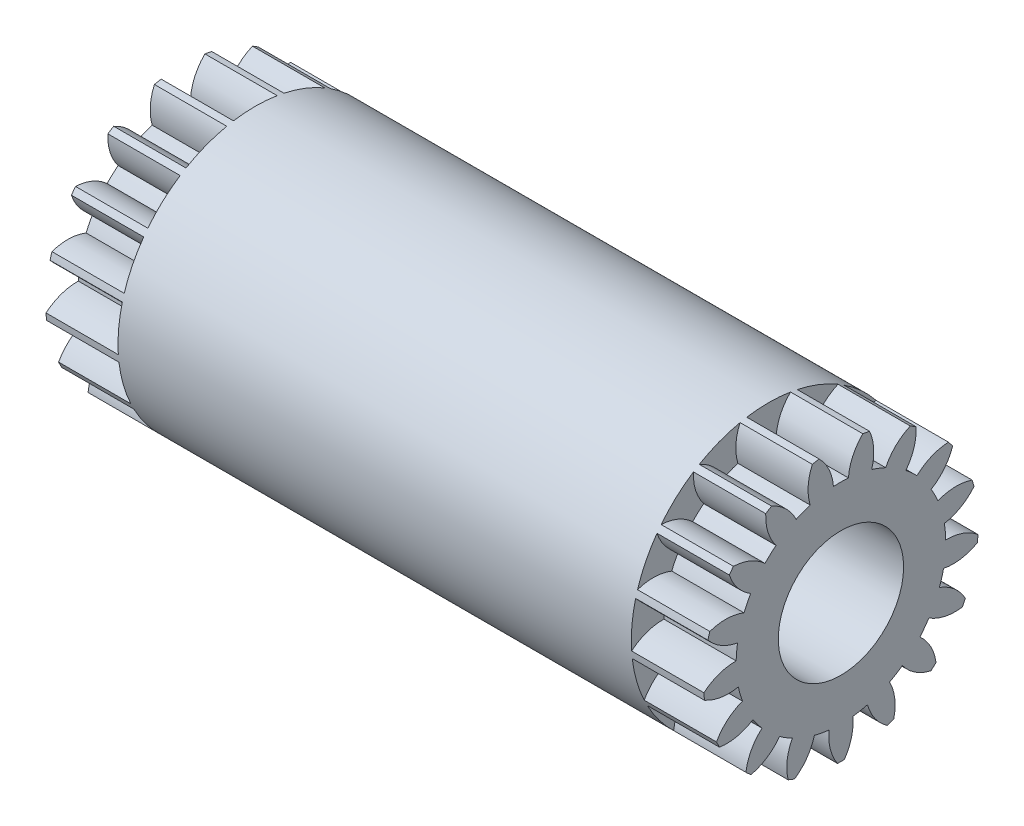
from build123d import *
from build123d.topology import SkipClean

# Parameters (mm, degrees)
BASPROSKE_W         = 3
BASPROSKE_H         = 5.7
TOOTHCUT_DEPTH      = 9.601162712
TEETHCUTS_COUNT     = 17
TEETHCUTS_ANGLE     = 338.823529412
HUBNEABOTSKE_R      = 1.5
HUBNEARBOTH_DEPTH   = 23.5000254
HUBFAR_START        = 23.5000254
HUBFARSKE_R         = 1.5
HUBFAR_DEPTH        = 23.5000254
BORSKE_R            = 2.5
BORE_DEPTH          = 50.0000508
EXTRUDE_START       = 21.3
SKETCH_2_R          = 5.7
EXTRUDE_1_DEPTH     = 21.3
EXTRUDE_2_DEPTH     = 3
SKETCH_4_R          = 2.6
CUT_EXTRUDE_1_DEPTH = 29.465241963


with BuildPart() as part:
    # BasProSke → Base-Revolve (revolve)
    with BuildSketch(Plane(origin=(0, 0, 0), x_dir=(1, 0, 0), z_dir=(0, 1, 0))):
        with Locations((1.5, 2.85)):
            Rectangle(BASPROSKE_W, BASPROSKE_H)
    revolve(axis=Axis((-10, 0, 0), (1, 0, 0)))

    # TooCutSke → ToothCut (cut, through all)
    with BuildSketch(Plane(origin=(0, 0, 0), x_dir=(0, 0, -1), z_dir=(1, 0, 0))):
        with BuildLine():
            ThreePointArc((0.310384518, 4.337909917), (0, 4.349), (-0.310384518, 4.337909917))
            ThreePointArc((-0.310384518, 4.337909917), (-0.499365984, 5.050550631), (-0.929319613, 5.649475216))
            ThreePointArc((-0.929319613, 5.649475216), (0, 5.7254), (0.929319613, 5.649475216))
            ThreePointArc((0.929319613, 5.649475216), (0.499365984, 5.050550631), (0.310384518, 4.337909917))
        make_face()
    toothcut = extrude(amount=TOOTHCUT_DEPTH, mode=Mode.SUBTRACT)

    # TeethCuts: ToothCut ×17 about axis
    teethcuts_axis = Axis((-10, 0, 0), (1, 0, 0))
    for i in range(1, TEETHCUTS_COUNT):
        add(toothcut.rotate(teethcuts_axis, i * TEETHCUTS_ANGLE / (TEETHCUTS_COUNT - 1)), mode=Mode.SUBTRACT)

    # HubNeaBotSke → HubNearBoth (add)
    with BuildSketch(Plane.ZY):
        Circle(HUBNEABOTSKE_R)
    extrude(amount=HUBNEARBOTH_DEPTH)

    # HubFarSke → HubFar (add)
    with BuildSketch(Plane(origin=(3, 0, 0), x_dir=(0, 0, -1), z_dir=(1, 0, 0)).offset(HUBFAR_START)):
        Circle(HUBFARSKE_R)
    extrude(amount=-HUBFAR_DEPTH)

    # BorSke → Bore (cut, symmetric)
    with BuildSketch(Plane(origin=(0, 0, 0), x_dir=(0, 0, -1), z_dir=(1, 0, 0))):
        Circle(BORSKE_R)
    extrude(amount=BORE_DEPTH, both=True, mode=Mode.SUBTRACT)

    # 草图2 → 凸台-拉伸1 (add)
    with BuildSketch(Plane(origin=(3, 0, 0), x_dir=(0, 0, -1), z_dir=(1, 0, 0)).offset(EXTRUDE_START)):
        Circle(SKETCH_2_R)
    extrude(amount=-EXTRUDE_1_DEPTH)

    # 草图3 → 凸台-拉伸2 (add)
    with SkipClean():  # the faces are left unmerged after this step: merging them gives an invalid solid
        with BuildSketch(Plane(origin=(24.3, 0, 0), x_dir=(0, 0, -1), z_dir=(1, 0, 0))):
            with BuildLine():
                ThreePointArc((-5.51974328, 1.422123104), (-4.969313038, 0.955273271), (-4.290766488, 0.709312304))
                ThreePointArc((-4.290766488, 0.709312304), (-4.330447933, 0.401275095), (-4.348043829, 0.091191359))
                ThreePointArc((-4.348043829, 0.091191359), (-5.060232043, -0.025899053), (-5.687073596, -0.38365859))
                ThreePointArc((-5.687073596, -0.38365859), (-5.675684805, -0.525929649), (-5.660737442, -0.667870958))
                ThreePointArc((-5.660737442, -0.667870958), (-4.978830915, -0.904357125), (-4.257253752, -0.88858961))
                ThreePointArc((-4.257253752, -0.88858961), (-4.182979722, -1.190160344), (-4.087372241, -1.485661187))
                ThreePointArc((-4.087372241, -1.485661187), (-4.709170038, -1.852116803), (-5.164444727, -2.412158922))
                ThreePointArc((-5.164444727, -2.412158922), (-5.102430761, -2.540708628), (-5.037217645, -2.667665346))
                ThreePointArc((-5.037217645, -2.667665346), (-4.315930089, -2.64184908), (-3.648775306, -2.366482573))
                ThreePointArc((-3.648775306, -2.366482573), (-3.470576921, -2.620858034), (-3.274678383, -2.861866958))
                ThreePointArc((-3.274678383, -2.861866958), (-3.722108524, -3.428195915), (-3.94432898, -4.114883826))
                ThreePointArc((-3.94432898, -4.114883826), (-3.840065169, -4.212350828), (-3.733393692, -4.307176748))
                ThreePointArc((-3.733393692, -4.307176748), (-3.070138988, -4.022544678), (-2.547509536, -3.524768952))
                ThreePointArc((-2.547509536, -3.524768952), (-2.289453476, -3.697594323), (-2.019721064, -3.851561738))
                ThreePointArc((-2.019721064, -3.851561738), (-2.232355629, -4.541278172), (-2.191509748, -5.261870867))
                ThreePointArc((-2.191509748, -5.261870867), (-2.059077497, -5.315091708), (-1.925354235, -5.364980062))
                ThreePointArc((-1.925354235, -5.364980062), (-1.409708605, -4.859973327), (-1.102188487, -4.207015752))
                ThreePointArc((-1.102188487, -4.207015752), (-0.799126653, -4.274950011), (-0.491989224, -4.321081763))
                ThreePointArc((-0.491989224, -4.321081763), (-0.441110737, -5.041035649), (-0.142714981, -5.698213091))
                ThreePointArc((-0.142714981, -5.698213091), (0, -5.7), (0.142714981, -5.698213091))
                ThreePointArc((0.142714981, -5.698213091), (0.441110737, -5.041035649), (0.491989224, -4.321081763))
                ThreePointArc((0.491989224, -4.321081763), (0.799126653, -4.274950011), (1.102188487, -4.207015752))
                ThreePointArc((1.102188487, -4.207015752), (1.409708605, -4.859973327), (1.925354235, -5.364980062))
                ThreePointArc((1.925354235, -5.364980062), (2.059077497, -5.315091708), (2.191509748, -5.261870867))
                ThreePointArc((2.191509748, -5.261870867), (2.232355629, -4.541278172), (2.019721064, -3.851561738))
                ThreePointArc((2.019721064, -3.851561738), (2.289453476, -3.697594323), (2.547509536, -3.524768952))
                ThreePointArc((2.547509536, -3.524768952), (3.070138988, -4.022544678), (3.733393692, -4.307176748))
                ThreePointArc((3.733393692, -4.307176748), (3.840065169, -4.212350828), (3.94432898, -4.114883826))
                ThreePointArc((3.94432898, -4.114883826), (3.722108524, -3.428195915), (3.274678383, -2.861866958))
                ThreePointArc((3.274678383, -2.861866958), (3.470576921, -2.620858034), (3.648775306, -2.366482573))
                ThreePointArc((3.648775306, -2.366482573), (4.315930089, -2.64184908), (5.037217645, -2.667665346))
                ThreePointArc((5.037217645, -2.667665346), (5.102430761, -2.540708628), (5.164444727, -2.412158922))
                ThreePointArc((5.164444727, -2.412158922), (4.709170038, -1.852116803), (4.087372241, -1.485661187))
                ThreePointArc((4.087372241, -1.485661187), (4.182979722, -1.190160344), (4.257253752, -0.88858961))
                ThreePointArc((4.257253752, -0.88858961), (4.978830915, -0.904357125), (5.660737442, -0.667870958))
                ThreePointArc((5.660737442, -0.667870958), (5.675684805, -0.525929649), (5.687073596, -0.38365859))
                ThreePointArc((5.687073596, -0.38365859), (5.060232043, -0.025899053), (4.348043829, 0.091191359))
                ThreePointArc((4.348043829, 0.091191359), (4.330447933, 0.401275095), (4.290766488, 0.709312304))
                ThreePointArc((4.290766488, 0.709312304), (4.969313038, 0.955273271), (5.51974328, 1.422123104))
                ThreePointArc((5.51974328, 1.422123104), (5.482406166, 1.559879043), (5.441631663, 1.696656961))
                ThreePointArc((5.441631663, 1.696656961), (4.727881672, 1.803816507), (4.021488004, 1.655728007))
                ThreePointArc((4.021488004, 1.655728007), (3.893065154, 1.938516109), (3.744787435, 2.211417661))
                ThreePointArc((3.744787435, 2.211417661), (4.288661899, 2.685888718), (4.633277202, 3.320051561))
                ThreePointArc((4.633277202, 3.320051561), (4.548698195, 3.435017427), (4.461267221, 3.547829588))
                ThreePointArc((4.461267221, 3.547829588), (3.757004683, 3.389916652), (3.15180794, 2.996649413))
                ThreePointArc((3.15180794, 2.996649413), (2.929902354, 3.213949781), (2.693054087, 3.414858809))
                ThreePointArc((2.693054087, 3.414858809), (3.028803207, 4.053760011), (3.121061365, 4.769588657))
                ThreePointArc((3.121061365, 4.769588657), (3.000663328, 4.846237674), (2.87838392, 4.91984817))
                ThreePointArc((2.87838392, 4.91984817), (2.278723393, 4.51818977), (1.85645875, 3.932856711))
                ThreePointArc((1.85645875, 3.932856711), (1.571040006, 4.055321726), (1.277608863, 4.157104352))
                ThreePointArc((1.277608863, 4.157104352), (1.359887858, 4.874148552), (1.187328895, 5.574966376))
                ThreePointArc((1.187328895, 5.574966376), (1.047372252, 5.602946668), (0.906758921, 5.627413994))
                ThreePointArc((0.906758921, 5.627413994), (0.492687882, 5.036256322), (0.310384518, 4.337909917))
                ThreePointArc((0.310384518, 4.337909917), (0, 4.349), (-0.310384518, 4.337909917))
                ThreePointArc((-0.310384518, 4.337909917), (-0.492687882, 5.036256322), (-0.906758921, 5.627413994))
                ThreePointArc((-0.906758921, 5.627413994), (-1.047372252, 5.602946668), (-1.187328895, 5.574966376))
                ThreePointArc((-1.187328895, 5.574966376), (-1.359887858, 4.874148552), (-1.277608863, 4.157104352))
                ThreePointArc((-1.277608863, 4.157104352), (-1.571040006, 4.055321726), (-1.85645875, 3.932856711))
                ThreePointArc((-1.85645875, 3.932856711), (-2.278723393, 4.51818977), (-2.87838392, 4.91984817))
                ThreePointArc((-2.87838392, 4.91984817), (-3.000663328, 4.846237674), (-3.121061365, 4.769588657))
                ThreePointArc((-3.121061365, 4.769588657), (-3.028803207, 4.053760011), (-2.693054087, 3.414858809))
                ThreePointArc((-2.693054087, 3.414858809), (-2.929902354, 3.213949781), (-3.15180794, 2.996649413))
                ThreePointArc((-3.15180794, 2.996649413), (-3.757004683, 3.389916652), (-4.461267221, 3.547829588))
                ThreePointArc((-4.461267221, 3.547829588), (-4.548698195, 3.435017427), (-4.633277202, 3.320051561))
                ThreePointArc((-4.633277202, 3.320051561), (-4.288661899, 2.685888718), (-3.744787435, 2.211417661))
                ThreePointArc((-3.744787435, 2.211417661), (-3.893065154, 1.938516109), (-4.021488004, 1.655728007))
                ThreePointArc((-4.021488004, 1.655728007), (-4.727881672, 1.803816507), (-5.441631663, 1.696656961))
                ThreePointArc((-5.441631663, 1.696656961), (-5.482406166, 1.559879043), (-5.51974328, 1.422123104))
            make_face()
        extrude(amount=EXTRUDE_2_DEPTH)

    # 草图4 → 切除-拉伸1 (cut, through all)
    with SkipClean():  # the faces are left unmerged after this step: merging them gives an invalid solid
        with BuildSketch(Plane(origin=(27.3, 0, 0), x_dir=(0, 0, -1), z_dir=(1, 0, 0))):
            Circle(SKETCH_4_R)
        extrude(amount=-CUT_EXTRUDE_1_DEPTH, mode=Mode.SUBTRACT)


solid = part.part
